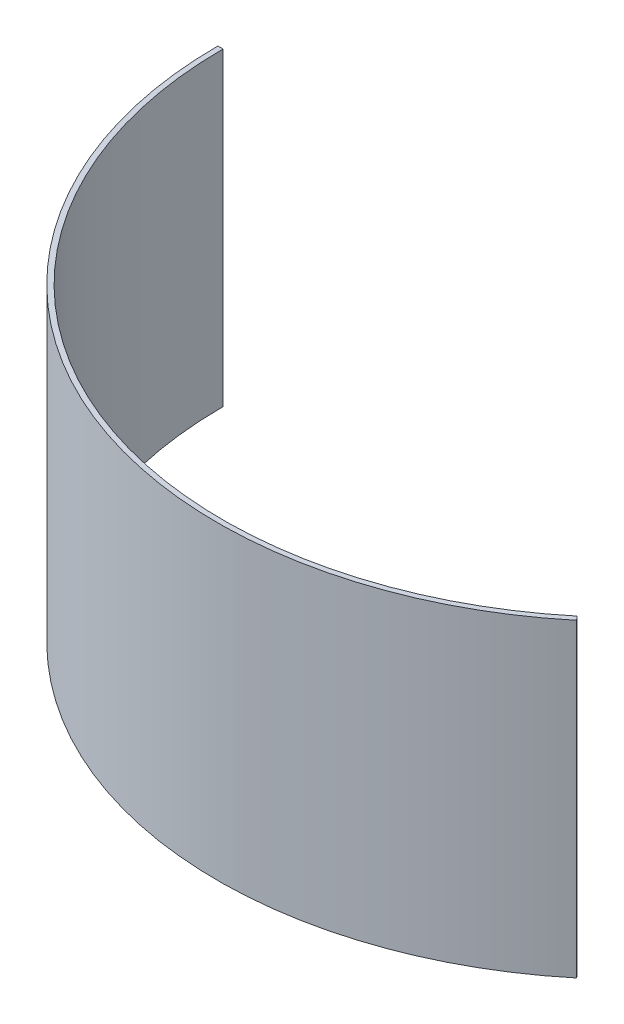
from build123d import *

# Parameters (mm, degrees)
SKETCH1_W      = 2.54
SKETCH1_H      = 152.4
REVOLVE1_ANGLE = 129.66


with BuildPart() as part:
    # Sketch1 → Revolve1 (revolve)
    with BuildSketch(Plane.XY):
        with Locations((1.27, 76.2)):
            Rectangle(SKETCH1_W, SKETCH1_H)
    revolve(axis=Axis((203.2, 0, 0), (0, 1, 0)), revolution_arc=REVOLVE1_ANGLE)


solid = part.part
